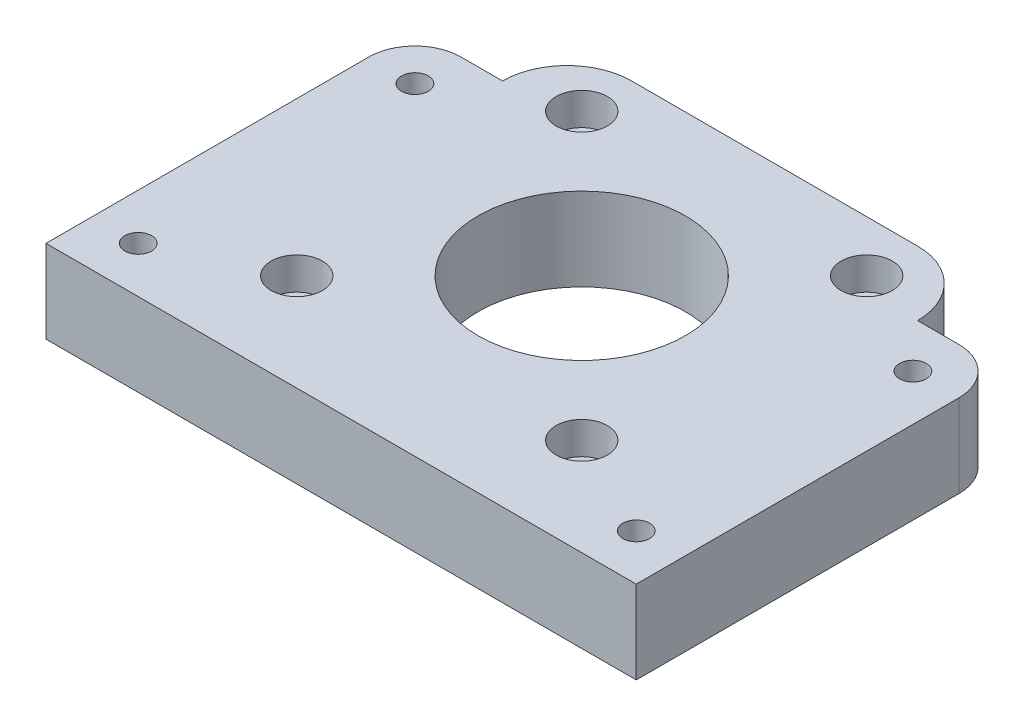
from build123d import *

# Parameters (mm, degrees)
BOSS_EXTRUDE1_DEPTH = 9
SKETCH2_R           = 11.25
CUT_EXTRUDE1_DEPTH  = 9
SKETCH3_R           = 2.775
CUT_EXTRUDE2_DEPTH  = 3.5
SKETCH5_R           = 2.775
CUT_EXTRUDE4_DEPTH  = 3.5
SKETCH4_R           = 1.5
CUT_EXTRUDE3_DEPTH  = 6
SKETCH6_R           = 1.45
CUT_EXTRUDE5_DEPTH  = 6


with BuildPart() as part:
    # Sketch1 → Boss-Extrude1 (new body)
    with BuildSketch(Plane(origin=(0, 0, 0), x_dir=(1, 0, 0), z_dir=(0, 1, 0))):
        with BuildLine():
            Line((-15.5, 29.5), (15.5, 29.5))
            ThreePointArc((15.5, 29.5), (20.449747468, 27.449747468), (22.5, 22.5))
            Line((22.5, 22.5), (27, 22.5))
            ThreePointArc((27, 22.5), (30.535533906, 21.035533906), (32, 17.5))
            Line((32, 17.5), (32, -17.5))
            Line((32, -17.5), (-32, -17.5))
            Line((-32, -17.5), (-32, 17.5))
            ThreePointArc((-32, 17.5), (-30.535533906, 21.035533906), (-27, 22.5))
            Line((-27, 22.5), (-22.5, 22.5))
            ThreePointArc((-22.5, 22.5), (-20.449747468, 27.449747468), (-15.5, 29.5))
        make_face()
    extrude(amount=BOSS_EXTRUDE1_DEPTH)

    # Sketch2 → Cut-Extrude1 (cut)
    with BuildSketch(Plane(origin=(0, 9, 0), x_dir=(1, 0, 0), z_dir=(0, 1, 0))):
        with Locations((0.09, 8.5)):
            Circle(SKETCH2_R)
    extrude(amount=-CUT_EXTRUDE1_DEPTH, mode=Mode.SUBTRACT)

    # Sketch3 → Cut-Extrude2 (cut)
    with BuildSketch(Plane(origin=(0, 9, 0), x_dir=(1, 0, 0), z_dir=(0, 1, 0))):
        with Locations((-15.360283169, 23.950283169)):
            Circle(SKETCH3_R)
        with Locations((15.540283169, 23.950283169)):
            Circle(SKETCH3_R)
        with Locations((15.540283169, -6.950283169)):
            Circle(SKETCH3_R)
        with Locations((-15.360283169, -6.950283169)):
            Circle(SKETCH3_R)
    extrude(amount=-CUT_EXTRUDE2_DEPTH, mode=Mode.SUBTRACT)

    # Sketch5 → Cut-Extrude4 (cut)
    with BuildSketch(Plane(origin=(0, 0, 0), x_dir=(1, 0, 0), z_dir=(0, 1, 0))):
        with Locations((-27, 17.5)):
            Circle(SKETCH5_R)
        with Locations((27, 17.5)):
            Circle(SKETCH5_R)
        with Locations((27, -12.5)):
            Circle(SKETCH5_R)
        with Locations((-27, -12.5)):
            Circle(SKETCH5_R)
    extrude(amount=CUT_EXTRUDE4_DEPTH, mode=Mode.SUBTRACT)

    # Sketch4 → Cut-Extrude3 (cut)
    with BuildSketch(Plane(origin=(0, 5.5, 0), x_dir=(1, 0, 0), z_dir=(0, 1, 0))):
        with Locations((-15.360283169, 23.950283169)):
            Circle(SKETCH4_R)
        with Locations((15.540283169, 23.950283169)):
            Circle(SKETCH4_R)
        with Locations((15.540283169, -6.950283169)):
            Circle(SKETCH4_R)
        with Locations((-15.360283169, -6.950283169)):
            Circle(SKETCH4_R)
    extrude(amount=-CUT_EXTRUDE3_DEPTH, mode=Mode.SUBTRACT)

    # Sketch6 → Cut-Extrude5 (cut)
    with BuildSketch(Plane(origin=(0, 3.5, 0), x_dir=(-1, 0, 0), z_dir=(0, -1, 0))):
        with Locations((-27, -12.5)):
            Circle(SKETCH6_R)
        with Locations((-27, 17.5)):
            Circle(SKETCH6_R)
        with Locations((27, 17.5)):
            Circle(SKETCH6_R)
        with Locations((27, -12.5)):
            Circle(SKETCH6_R)
    extrude(amount=-CUT_EXTRUDE5_DEPTH, mode=Mode.SUBTRACT)


solid = part.part
